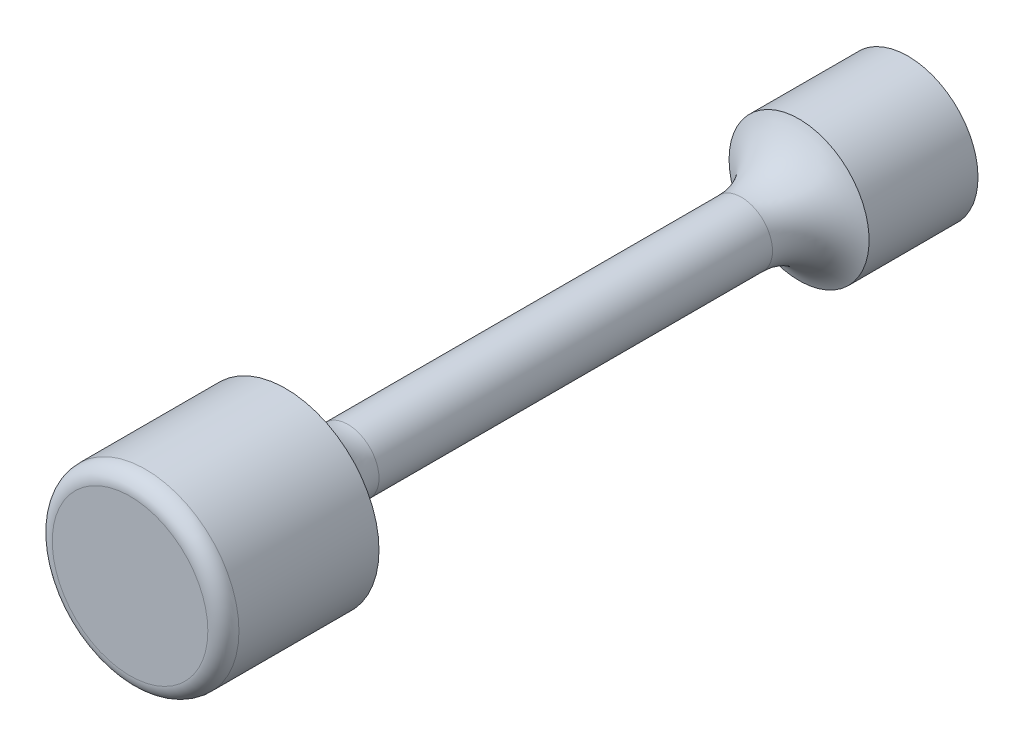
from build123d import *

# Parameters (mm, degrees)
SKETCH_1_R          = 2.25
EXTRUDE_2_DEPTH     = 20
SKETCH_7_W          = 2.4
SKETCH_7_H          = 2.4
CUT_EXTRUDE_3_DEPTH = 2.5
SKETCH_9_R          = 3
EXTRUDE_4_DEPTH     = 5
CUT_EXTRUDE_START   = -20
SKETCH_12_OUTSIDE_W = 13.28
SKETCH_12_OUTSIDE_H = 13.28
SKETCH_12_OUTSIDE_R = 1
CUT_EXTRUDE_4_DEPTH = 16.5
FILLET_2_R          = 2
FILLET_3_R          = 0.5


with BuildPart() as part:
    # 草图1 → 凸台-拉伸2 (new body)
    with BuildSketch(Plane.XY):
        Circle(SKETCH_1_R)
    extrude(amount=EXTRUDE_2_DEPTH)

    # 草图7 → 切除-拉伸3 (cut)
    with BuildSketch(Plane.XY):
        Rectangle(SKETCH_7_W, SKETCH_7_H)
    extrude(amount=CUT_EXTRUDE_3_DEPTH, mode=Mode.SUBTRACT)

    # 草图9 → 凸台-拉伸4 (add)
    with BuildSketch(Plane.XY.offset(20)):
        Circle(SKETCH_9_R)
    extrude(amount=EXTRUDE_4_DEPTH)

    # 草图12 outside → 切除-拉伸4 (cut)
    with BuildSketch(Plane(origin=(0, 0, 0), x_dir=(-1, 0, 0), z_dir=(0, 0, -1)).offset(CUT_EXTRUDE_START)):
        Rectangle(SKETCH_12_OUTSIDE_W, SKETCH_12_OUTSIDE_H)
        with Locations(Location((0, 0, 0), (0, 0, 180))):
            Circle(SKETCH_12_OUTSIDE_R, mode=Mode.SUBTRACT)
    extrude(amount=CUT_EXTRUDE_4_DEPTH, mode=Mode.SUBTRACT)

    # 圆角2
    # the kernel refuses this fillet: 2 mm, written as the material it adds along each edge
    with BuildSketch(Plane(origin=(0, 0, 3.5), x_dir=(1, 0, 0), z_dir=(0, 1, 0))) as fillet_2_piece_1:
        with BuildLine():
            CenterArc((3, -1.854049622), FILLET_2_R, 112.024312837, 67.975687163)
            Line((2.25, 0), (2.235, 0.037080992))
            ThreePointArc((2.235, 0.037080992), (1.625, 0.04), (1, 0.04))
            Line((1, 0.04), (0.96, 0))
            Line((0.96, 0), (0.96, -1.854049622))
            Line((0.96, -1.854049622), (1, -1.854049622))
        make_face()
    revolve(axis=Axis((0, 0, 3.5), (0, 0, -1)))
    with BuildSketch(Plane(origin=(0, 0, 20), x_dir=(1, 0, 0), z_dir=(0, 1, 0))) as fillet_2_piece_2:
        with BuildLine():
            CenterArc((1 + FILLET_2_R, FILLET_2_R), FILLET_2_R, 180, 90)
            Line((1, FILLET_2_R), (1 - FILLET_2_R * 0.02, FILLET_2_R))
            Line((1 - FILLET_2_R * 0.02, FILLET_2_R), (1 - FILLET_2_R * 0.02, -FILLET_2_R * 0.02))
            Line((1 - FILLET_2_R * 0.02, -FILLET_2_R * 0.02), (1 + FILLET_2_R, -FILLET_2_R * 0.02))
            Line((1 + FILLET_2_R, -FILLET_2_R * 0.02), (1 + FILLET_2_R, 0))
        make_face()
    revolve(axis=Axis((0, 0, 20), (0, 0, -1)))

    # 圆角3
    fillet_3_edges = [part.edges().sort_by_distance(p)[0] for p in [
        (-3, 0, 25),
    ]]
    fillet(fillet_3_edges, radius=FILLET_3_R)


solid = part.part
